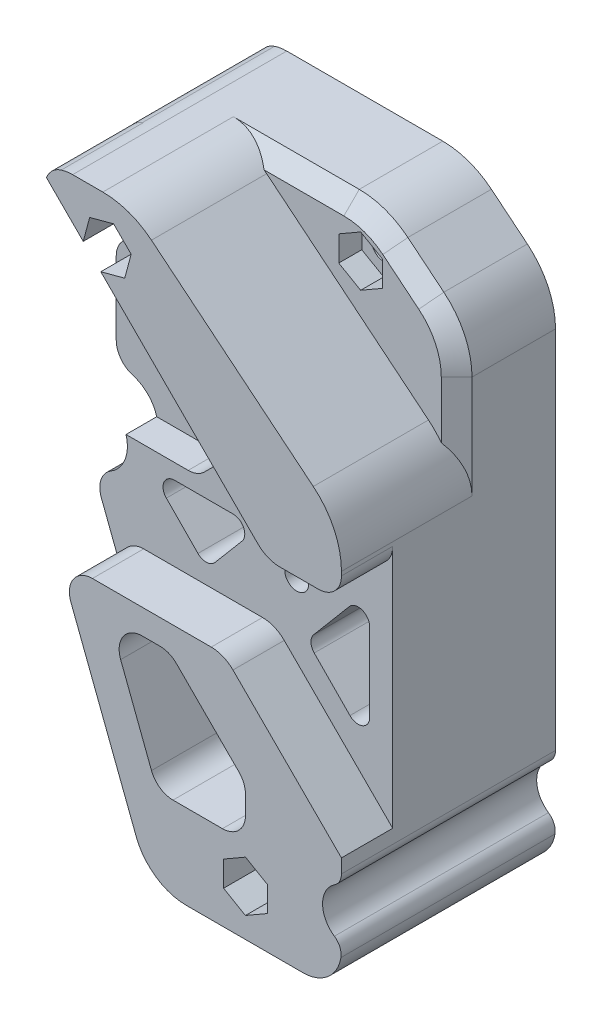
from build123d import *
from build123d.topology import SkipClean

# Parameters (mm, degrees)
SKETCH1_R            = 1.5
SKETCH1_W            = 15
SKETCH1_H            = 37.5
BOSS_EXTRUDE1_DEPTH  = 2.85
FILLET1_R            = 5
FILLET2_R            = 2
BOSS_EXTRUDE2_START  = 3.5
SKETCH5_R            = 1.5
BOSS_EXTRUDE2_DEPTH  = 3.5
FILLET3_R            = 3.5
FILLET4_R            = 2
FILLET5_R            = 2
SKETCH6_R            = 1.5
CUT_EXTRUDE1_DEPTH   = 10
SKETCH8_R            = 1.5
BOSS_EXTRUDE3_DEPTH  = 6.35
BOSS_EXTRUDE4_START  = 3.175
SKETCH9_R            = 1.5
BOSS_EXTRUDE4_DEPTH  = 3.175
SKETCH10_W           = 40
SKETCH10_H           = 15.399494937
SKETCH10_W_2         = 25
BOSS_EXTRUDE5_DEPTH  = 6.675
CUT_EXTRUDE2_START   = -6.675
CUT_EXTRUDE2_DEPTH   = 6.675
BOSS_EXTRUDE6_START  = -9.2
BOSS_EXTRUDE6_DEPTH  = 9.2
FILLET6_R            = 7
BOSS_EXTRUDE7_DEPTH  = 6.675
FILLET7_R            = 3
FILLET8_R            = 1.5
SKETCH14_R           = 1.5
CUT_EXTRUDE3_DEPTH   = 81.63507689
SKETCH15_R           = 1.55
CUT_EXTRUDE4_DEPTH   = 81.63507689
BOSS_EXTRUDE8_START  = 12
SKETCH17_R           = 1.55
BOSS_EXTRUDE8_DEPTH  = 12
SKETCH18_R           = 1.55
CUT_EXTRUDE5_DEPTH   = 15
CUT_EXTRUDE6_DEPTH   = 84.827296419
FILLET9_R            = 10
FILLET10_R           = 10
CUT_EXTRUDE7_DEPTH   = 4
FILLET11_R           = 3
BOSS_EXTRUDE9_START  = 4
BOSS_EXTRUDE9_DEPTH  = 4
FILLET12_R           = 3
CUT_EXTRUDE8_DEPTH   = 81.906365633
FILLET13_R           = 2
CUT_EXTRUDE9_DEPTH   = 84.827296419
FILLET14_R           = 3
CUT_EXTRUDE11_DEPTH  = 5
CUT_EXTRUDE12_DEPTH  = 3
SKETCH29_W           = 72.59
SKETCH29_H           = 13.5
CUT_EXTRUDE13_DEPTH  = 6.675
FILLET15_R           = 3
CHAMFER2_SIZE        = 2
SKETCH30_R           = 4.55
SKETCH30_R_2         = 1.55
CUT_EXTRUDE14_DEPTH  = 84.827296419
FILLET16_R           = 3
BOSS_EXTRUDE10_START = -17.2
BOSS_EXTRUDE10_DEPTH = 17.2
FILLET17_R           = 3
BOSS_EXTRUDE11_START = -17.2
BOSS_EXTRUDE11_DEPTH = 17.2
CUT_EXTRUDE15_START  = 10
CUT_EXTRUDE15_DEPTH  = 10
BOSS_EXTRUDE12_DEPTH = 5
CUT_EXTRUDE16_START  = -6.675
SKETCH35_R           = 1.55
CUT_EXTRUDE16_DEPTH  = 6.675
FILLET18_R           = 4
SKETCH36_R           = 3.5
CUT_EXTRUDE17_DEPTH  = 84.827296419
FILLET19_R           = 2
CUT_EXTRUDE18_DEPTH  = 82.850107051
FILLET20_R           = 1.5
CUT_EXTRUDE19_DEPTH  = 82.850107051
FILLET21_R           = 1.5
SCALE1_SCALE         = 0.333333333


with BuildPart() as part:
    # Sketch1 → Boss-Extrude1 (new body)
    # profile 1 of 2: a face of its own
    with BuildSketch(Plane.XY):
        Polygon((0, 37.5), (0, 0), (25, 0), (25, 75), (0, 75), align=None)
        with Locations((12.5, 6)):
            Circle(SKETCH1_R, mode=Mode.SUBTRACT)
        with Locations((12.5, 37.5)):
            Circle(SKETCH1_R, mode=Mode.SUBTRACT)
        with Locations((12.5, 69)):
            Circle(SKETCH1_R, mode=Mode.SUBTRACT)
    # profile 2 of 2: a face of its own
    with BuildSketch(Plane.XY):
        with Locations((-7.5, 56.25)):
            Rectangle(SKETCH1_W, SKETCH1_H)
    extrude(amount=BOSS_EXTRUDE1_DEPTH)

    # Fillet1
    fillet1_edges = [part.edges().sort_by_distance(p)[0] for p in [
        (25, 75, 1.425),
        (25, 0, 1.425),
        (0, 0, 1.425),
        (0, 37.5, 1.425),
        (-15, 75, 1.425),
    ]]
    fillet(fillet1_edges, radius=FILLET1_R)

    # Fillet2
    fillet2_edges = [part.edges().sort_by_distance(p)[0] for p in [
        (-15, 37.5, 1.425),
    ]]
    fillet(fillet2_edges, radius=FILLET2_R)

    # Sketch5 → Boss-Extrude2 (add)
    # profile 1 of 2: a face of its own
    with BuildSketch(Plane.XY.offset(2.85).offset(BOSS_EXTRUDE2_START)):
        with BuildLine():
            Line((-15, 42.5), (10.428932188, 42.5))
            Line((10.428932188, 42.5), (21.464466094, 53.535533906))
            Line((21.464466094, 53.535533906), (25, 57.071067812))
            Line((25, 57.071067812), (25, 70))
            ThreePointArc((25, 70), (23.535533906, 73.535533906), (20, 75))
            Line((20, 75), (-10, 75))
            ThreePointArc((-10, 75), (-13.535533906, 73.535533906), (-15, 70))
            Line((-15, 70), (-15, 42.5))
        make_face()
        with Locations((12.5, 69)):
            Circle(SKETCH5_R, mode=Mode.SUBTRACT)
    # profile 2 of 2: a face of its own
    with BuildSketch(Plane.XY.offset(2.85).offset(BOSS_EXTRUDE2_START)):
        with BuildLine():
            Line((14.571067812, 32.5), (0, 17.928932188))
            Line((0, 17.928932188), (0, 5))
            ThreePointArc((0, 5), (1.464466094, 1.464466094), (5, 0))
            Line((5, 0), (20, 0))
            ThreePointArc((20, 0), (23.535533906, 1.464466094), (25, 5))
            Line((25, 5), (25, 32.5))
            Line((25, 32.5), (14.571067812, 32.5))
        make_face()
        with Locations((12.5, 6)):
            Circle(SKETCH5_R, mode=Mode.SUBTRACT)
    extrude(amount=-BOSS_EXTRUDE2_DEPTH)

    # Fillet3
    fillet3_edges = [part.edges().sort_by_distance(p)[0] for p in [
        (10.428932188, 42.5, 4.6),
        (14.571067812, 32.5, 4.6),
    ]]
    fillet(fillet3_edges, radius=FILLET3_R)

    # Fillet4
    fillet4_edges = [part.edges().sort_by_distance(p)[0] for p in [
        (-15, 42.5, 4.6),
    ]]
    fillet(fillet4_edges, radius=FILLET4_R)

    # Fillet5
    fillet5_edges = [part.edges().sort_by_distance(p)[0] for p in [
        (25, 57.071067812, 4.6),
        (25, 32.5, 4.6),
        (0, 17.928932188, 4.6),
    ]]
    fillet(fillet5_edges, radius=FILLET5_R)

    # Sketch6 → Cut-Extrude1 (cut)
    with BuildSketch(Plane.XY.offset(6.35)):
        with Locations((-5.5, 69)):
            Circle(SKETCH6_R)
    extrude(amount=-CUT_EXTRUDE1_DEPTH, mode=Mode.SUBTRACT)

    # Sketch8 → Boss-Extrude3 (add)
    with SkipClean():  # the faces are left unmerged after this step: merging them gives an invalid solid
        with BuildSketch(Plane(origin=(0, 0, 0), x_dir=(-1, 0, 0), z_dir=(0, 0, -1))):
            with BuildLine():
                ThreePointArc((0, 32.5), (1.464466094, 36.035533906), (5, 37.5))
                Line((5, 37.5), (13, 37.5))
                ThreePointArc((13, 37.5), (14.414213562, 38.085786438), (15, 39.5))
                Line((15, 39.5), (15, 70))
                ThreePointArc((15, 70), (13.535533906, 73.535533906), (10, 75))
                Line((10, 75), (-20, 75))
                ThreePointArc((-20, 75), (-23.535533906, 73.535533906), (-25, 70))
                Line((-25, 70), (-25, 5))
                ThreePointArc((-25, 5), (-23.535533906, 1.464466094), (-20, 0))
                Line((-20, 0), (-5, 0))
                ThreePointArc((-5, 0), (-1.464466094, 1.464466094), (0, 5))
                Line((0, 5), (0, 32.5))
            make_face()
            with Locations((-12.5, 6)):
                Circle(SKETCH8_R, mode=Mode.SUBTRACT)
            with Locations((-12.5, 69)):
                Circle(SKETCH8_R, mode=Mode.SUBTRACT)
            with Locations((-12.5, 37.5)):
                Circle(SKETCH8_R, mode=Mode.SUBTRACT)
            with Locations(Location((5.5, 69, 0), (0, 0, 180))):
                Circle(SKETCH8_R, mode=Mode.SUBTRACT)
        extrude(amount=BOSS_EXTRUDE3_DEPTH)
    add(part.part.scale(1), mode=Mode.REPLACE)  # the faces are merged on a copy

    # Sketch9 → Boss-Extrude4 (add)
    # profile 1 of 2: a face of its own
    with BuildSketch(Plane.XY.offset(6.35).offset(BOSS_EXTRUDE4_START)):
        with BuildLine():
            ThreePointArc((16.02081528, 32.5), (14.681423267, 32.233578364), (13.545941546, 31.474873734))
            Line((13.545941546, 31.474873734), (0.585786438, 18.514718626))
            ThreePointArc((0.585786438, 18.514718626), (0.152240935, 17.865871928), (0, 17.100505063))
            Line((0, 17.100505063), (0, 5))
            ThreePointArc((0, 5), (1.464466094, 1.464466094), (5, 0))
            Line((5, 0), (20, 0))
            ThreePointArc((20, 0), (23.535533906, 1.464466094), (25, 5))
            Line((25, 5), (25, 30.5))
            ThreePointArc((25, 30.5), (24.414213562, 31.914213562), (23, 32.5))
            Line((23, 32.5), (16.02081528, 32.5))
        make_face()
    # profile 2 of 2: a face of its own
    with BuildSketch(Plane.XY.offset(6.35).offset(BOSS_EXTRUDE4_START)):
        with BuildLine():
            ThreePointArc((8.97918472, 42.5), (10.318576733, 42.766421636), (11.454058454, 43.525126266))
            Line((11.454058454, 43.525126266), (24.414213562, 56.485281374))
            ThreePointArc((24.414213562, 56.485281374), (24.847759065, 57.134128072), (25, 57.899494937))
            Line((25, 57.899494937), (25, 70))
            ThreePointArc((25, 70), (23.535533906, 73.535533906), (20, 75))
            Line((20, 75), (-10, 75))
            ThreePointArc((-10, 75), (-13.535533906, 73.535533906), (-15, 70))
            Line((-15, 70), (-15, 44.5))
            ThreePointArc((-15, 44.5), (-14.414213562, 43.085786438), (-13, 42.5))
            Line((-13, 42.5), (8.97918472, 42.5))
        make_face()
        with Locations((-5.5, 69)):
            Circle(SKETCH9_R, mode=Mode.SUBTRACT)
        with Locations((12.5, 69)):
            Circle(SKETCH9_R, mode=Mode.SUBTRACT)
    extrude(amount=-BOSS_EXTRUDE4_DEPTH)

    # Sketch10 → Boss-Extrude5 (add)
    with SkipClean():  # the faces are left unmerged after this step: merging them gives an invalid solid
        with BuildSketch(Plane.XY.offset(9.525)):
            with Locations((5, 50.199747469)):
                Rectangle(SKETCH10_W, SKETCH10_H)
            with Locations((12.5, 24.800252531)):
                Rectangle(SKETCH10_W_2, SKETCH10_H)
        extrude(amount=-BOSS_EXTRUDE5_DEPTH)

    # Cut-Extrude2: read off the stored shape, not the designer's step
    # Cut-Extrude2 outline → Cut-Extrude2 (cut)
    with SkipClean():  # the faces are left unmerged after this step: merging them gives an invalid solid
        with BuildSketch(Plane.XY.offset(9.525).offset(CUT_EXTRUDE2_START)):
            Polygon((25, 32.5), (10.428932188, 32.5), (25, 17.928932188), align=None)
            with BuildLine():
                Line((-15, 42.5), (14.571067812, 42.5))
                Line((14.571067812, 42.5), (-14.682437359, 71.75350517))
                ThreePointArc((-14.682437359, 71.75350517), (-14.919968841, 70.891014367), (-15, 70))
                Line((-15, 70), (-15, 42.5))
            make_face()
        extrude(amount=CUT_EXTRUDE2_DEPTH, mode=Mode.SUBTRACT)

    # Sketch12 → Boss-Extrude6 (add)
    with BuildSketch(Plane(origin=(0, 0, -6.35), x_dir=(-1, 0, 0), z_dir=(0, 0, -1)).offset(BOSS_EXTRUDE6_START)):
        with BuildLine():
            Line((0, 0), (14.867488321, 38.784117768))
            ThreePointArc((14.867488321, 38.784117768), (14.133189202, 37.852006604), (13, 37.5))
            Line((13, 37.5), (5, 37.5))
            ThreePointArc((5, 37.5), (1.464466094, 36.035533906), (0, 32.5))
            Line((0, 32.5), (0, 5))
            ThreePointArc((0, 5), (-1.464466094, 1.464466094), (-5, 0))
            Line((-5, 0), (0, 0))
        make_face()
    extrude(amount=BOSS_EXTRUDE6_DEPTH)

    # Fillet6
    fillet6_edges = [part.edges().sort_by_distance(p)[0] for p in [
        (0, 0, -1.75),
    ]]
    fillet(fillet6_edges, radius=FILLET6_R)

    # Sketch13 → Boss-Extrude7 (add)
    with SkipClean():  # the faces are left unmerged after this step: merging them gives an invalid solid
        with BuildSketch(Plane.XY.offset(9.525)):
            with BuildLine():
                Line((0, 32.5), (0, 5))
                ThreePointArc((0, 5), (1.464466094, 1.464466094), (5, 0))
                Line((5, 0), (4.813322939, 0))
                ThreePointArc((4.813322939, 0), (0.847160732, 1.232023115), (-1.722886185, 4.494412187))
                Line((-1.722886185, 4.494412187), (-12.458537109, 32.5))
                Line((-12.458537109, 32.5), (0, 32.5))
            make_face()
        extrude(amount=-BOSS_EXTRUDE7_DEPTH)

    # Fillet7
    fillet7_edges = [part.edges().sort_by_distance(p)[0] for p in [
        (25, 42.5, 6.1875),
        (14.571067812, 42.5, 6.1875),
        (-14.682437359, 71.75350517, 4.6),
        (10.428932188, 32.5, 6.1875),
        (25, 17.928932188, 6.1875),
    ]]
    fillet(fillet7_edges, radius=FILLET7_R)

    # Fillet8
    # the kernel refuses this fillet: 1.5 mm, written as the material it takes off along each edge
    with BuildSketch(Plane(origin=(-12.458537109, 32.5, 14.978612885), x_dir=(0.35794111613384066, -0.9337441605605148, 0), z_dir=(0, 0, -1))) as fillet8_piece_1:
        with BuildLine():
            CenterArc((FILLET8_R * 1.45429676938, -FILLET8_R), FILLET8_R, 90, 110.97380664)
            Line((FILLET8_R * 0.520552608823, -FILLET8_R * 1.35794111613), (0, 0))
            Line((0, 0), (FILLET8_R * 1.45429676938, 0))
        make_face()
    extrude(amount=12.128612885, mode=Mode.SUBTRACT)

    # Sketch14 → Cut-Extrude3 (cut, through all)
    with SkipClean():  # the faces are left unmerged after this step: merging them gives an invalid solid
        with BuildSketch(Plane(origin=(0, 0, -6.35), x_dir=(-1, 0, 0), z_dir=(0, 0, -1))):
            with Locations((-12.5, 6)):
                Circle(SKETCH14_R)
        extrude(amount=-CUT_EXTRUDE3_DEPTH, mode=Mode.SUBTRACT)
    add(part.part.scale(1), mode=Mode.REPLACE)  # the faces are merged on a copy

    # Sketch15 → Cut-Extrude4 (cut, through all)
    with BuildSketch(Plane(origin=(0, 0, -6.35), x_dir=(-1, 0, 0), z_dir=(0, 0, -1))):
        with Locations((-12.5, 69)):
            Circle(SKETCH15_R)
        with Locations((5.5, 69)):
            Circle(SKETCH15_R)
        with Locations((-12.5, 37.5)):
            Circle(SKETCH15_R)
        with Locations((-12.5, 6)):
            Circle(SKETCH15_R)
    extrude(amount=-CUT_EXTRUDE4_DEPTH, mode=Mode.SUBTRACT)

    # Sketch17 → Boss-Extrude8 (add)
    with BuildSketch(Plane(origin=(0, 0, -6.35), x_dir=(-1, 0, 0), z_dir=(0, 0, -1)).offset(BOSS_EXTRUDE8_START)):
        with BuildLine():
            ThreePointArc((-25, 5), (-23.535533906, 1.464466094), (-20, 0))
            Line((-20, 0), (-4.813322939, 0))
            ThreePointArc((-4.813322939, 0), (-0.847160732, 1.232023115), (1.722886185, 4.494412187))
            Line((1.722886185, 4.494412187), (14.867488321, 38.784117768))
            ThreePointArc((14.867488321, 38.784117768), (14.966593075, 39.135978464), (15, 39.5))
            Line((15, 39.5), (15, 70))
            ThreePointArc((15, 70), (13.535533906, 73.535533906), (10, 75))
            Line((10, 75), (-20, 75))
            ThreePointArc((-20, 75), (-23.535533906, 73.535533906), (-25, 70))
            Line((-25, 70), (-25, 5))
        make_face()
        with Locations((-12.5, 37.5)):
            Circle(SKETCH17_R, mode=Mode.SUBTRACT)
        with Locations((-12.5, 69)):
            Circle(SKETCH17_R, mode=Mode.SUBTRACT)
        with Locations((5.5, 69)):
            Circle(SKETCH17_R, mode=Mode.SUBTRACT)
        with Locations((-12.5, 6)):
            Circle(SKETCH17_R, mode=Mode.SUBTRACT)
    extrude(amount=-BOSS_EXTRUDE8_DEPTH)

    # Sketch18 → Cut-Extrude5 (cut)
    with BuildSketch(Plane.XY.offset(9.525)):
        with BuildLine():
            Line((20, 75), (-2.5, 75))
            Line((-2.5, 75), (25, 52.5))
            Line((25, 52.5), (25, 70))
            ThreePointArc((25, 70), (23.535533906, 73.535533906), (20, 75))
        make_face()
        with Locations(Location((12.5, 69, 0), (0, 0, 180))):
            Circle(SKETCH18_R, mode=Mode.SUBTRACT)
    extrude(amount=-CUT_EXTRUDE5_DEPTH, mode=Mode.SUBTRACT)

    # Sketch19 → Cut-Extrude6 (cut, through all)
    with BuildSketch(Plane.XY.offset(9.525)):
        with BuildLine():
            Line((13.888888889, 75), (20, 70))
            Line((20, 70), (25, 65.909090909))
            Line((25, 65.909090909), (25, 70))
            ThreePointArc((25, 70), (23.535533906, 73.535533906), (20, 75))
            Line((20, 75), (13.888888889, 75))
        make_face()
    extrude(amount=-CUT_EXTRUDE6_DEPTH, mode=Mode.SUBTRACT)

    # Fillet9
    fillet9_edges = [part.edges().sort_by_distance(p)[0] for p in [
        (25, 65.909090909, -11.9125),
        (13.888888889, 75, -11.9125),
    ]]
    fillet(fillet9_edges, radius=FILLET9_R)

    # Fillet10
    fillet10_edges = [part.edges().sort_by_distance(p)[0] for p in [
        (-2.5, 75, 2.025),
        (25, 52.5, 2.025),
    ]]
    fillet(fillet10_edges, radius=FILLET10_R)

    # Sketch20 → Cut-Extrude7 (cut)
    with BuildSketch(Plane.XY.offset(2.85)):
        with BuildLine():
            Line((15.813708499, 42.5), (-15, 42.5))
            Line((-15, 42.5), (-15, 70))
            ThreePointArc((-15, 70), (-14.027685763, 72.962726346), (-11.488901041, 74.773172288))
            ThreePointArc((-11.488901041, 74.773172288), (-13.508490052, 72.626793087), (-12.71688076, 69.787948572))
            Line((-12.71688076, 69.787948572), (13.692388155, 43.378679656))
            ThreePointArc((13.692388155, 43.378679656), (14.665658202, 42.728361402), (15.813708499, 42.5))
        make_face()
    extrude(amount=-CUT_EXTRUDE7_DEPTH, mode=Mode.SUBTRACT)

    # Fillet11
    fillet11_edges = [part.edges().sort_by_distance(p)[0] for p in [
        (-15, 42.5, 0.85),
    ]]
    fillet(fillet11_edges, radius=FILLET11_R - 0.0001)  # a hair under: the kernel refuses the full size

    # Sketch21 → Boss-Extrude9 (add)
    with BuildSketch(Plane.XY.offset(-1.15).offset(BOSS_EXTRUDE9_START)):
        with BuildLine():
            Line((13.692388155, 43.378679656), (7.090070927, 49.980996885))
            Line((7.090070927, 49.980996885), (-0.390925959, 42.5))
            Line((-0.390925959, 42.5), (15.813708499, 42.5))
            ThreePointArc((15.813708499, 42.5), (14.665658202, 42.728361402), (13.692388155, 43.378679656))
        make_face()
    extrude(amount=-BOSS_EXTRUDE9_DEPTH)

    # Fillet12
    # the kernel refuses this fillet: 3 mm, written as the material it adds along each edge
    with BuildSketch(Plane(origin=(7.090070927, 49.980996885, 2.85), x_dir=(-0.7071067811865475, -0.7071067811865475, 0), z_dir=(0, 0, -1))) as fillet12_piece_1:
        with BuildLine():
            CenterArc((FILLET12_R, FILLET12_R), FILLET12_R, 180, 90)
            Line((0, FILLET12_R), (0, 0))
            Line((0, 0), (FILLET12_R, 0))
        make_face()
    extrude(amount=11.5)
    with BuildSketch(Plane(origin=(-0.390925959, 42.5, 2.85), x_dir=(-1, 0, 0), z_dir=(0, 0, -1))) as fillet12_piece_2:
        with BuildLine():
            CenterArc((FILLET12_R * 0.414213562373, FILLET12_R), FILLET12_R, 225, 45)
            Line((-FILLET12_R * 0.292893218813, FILLET12_R * 0.292893218813), (0, 0))
            Line((0, 0), (FILLET12_R * 0.414213562373, 0))
        make_face()
    extrude(amount=7.106601718)

    # Sketch22 → Cut-Extrude8 (cut, through all)
    with BuildSketch(Plane.XY.offset(-1.15)):
        Polygon((-11, 62.414213562), (-11, 46.5), (-2.047780208, 46.5), (1.433216677, 49.980996885), align=None)
    extrude(amount=-CUT_EXTRUDE8_DEPTH, mode=Mode.SUBTRACT)

    # Fillet13
    fillet13_edges = [part.edges().sort_by_distance(p)[0] for p in [
        (-11, 62.414213562, -9.75),
        (1.433216677, 49.980996885, -9.75),
        (-2.047780208, 46.5, -9.75),
        (-11, 46.5, -9.75),
    ]]
    fillet(fillet13_edges, radius=FILLET13_R)

    # Sketch23 → Cut-Extrude9 (cut, through all)
    with BuildSketch(Plane.XY.offset(9.525)):
        Polygon((12.503863742, 10.999998507), (12.508975645, 17.615220221), (2.63184073, 27.507632025), (-5.307543542, 27.513767173), (1.004807677, 11.008884386), align=None)
    extrude(amount=-CUT_EXTRUDE9_DEPTH, mode=Mode.SUBTRACT)

    # Fillet14
    fillet14_edges = [part.edges().sort_by_distance(p)[0] for p in [
        (12.508975645, 17.615220221, -4.4125),
        (12.503863742, 10.999998507, -4.4125),
        (1.004807677, 11.008884386, -4.4125),
        (-5.307543542, 27.513767173, -4.4125),
        (2.63184073, 27.507632025, -4.4125),
    ]]
    fillet(fillet14_edges, radius=FILLET14_R)

    # Sketch26 → Cut-Extrude11 (cut)
    with BuildSketch(Plane.XY.offset(9.525)):
        Polygon((-5.5, 72.290896534), (-8.35, 70.645448267), (-8.35, 67.354551733), (-5.5, 65.709103466), (-2.65, 67.354551733), (-2.65, 70.645448267), align=None)
        Polygon((12.5, 9.290896534), (9.65, 7.645448267), (9.65, 4.354551733), (12.5, 2.709103466), (15.35, 4.354551733), (15.35, 7.645448267), align=None)
    extrude(amount=-CUT_EXTRUDE11_DEPTH, mode=Mode.SUBTRACT)

    # Sketch28 → Cut-Extrude12 (cut)
    with BuildSketch(Plane.XY.offset(-5.475)):
        Polygon((12.5, 72.290896534), (9.65, 70.645448267), (9.65, 67.354551733), (12.5, 65.709103466), (15.35, 67.354551733), (15.35, 70.645448267), align=None)
    extrude(amount=-CUT_EXTRUDE12_DEPTH, mode=Mode.SUBTRACT)

    # Sketch29 → Cut-Extrude13 (cut)
    with BuildSketch(Plane.XY.offset(9.525)):
        with Locations((12.5, 37.5)):
            Rectangle(SKETCH29_W, SKETCH29_H)
    extrude(amount=-CUT_EXTRUDE13_DEPTH, mode=Mode.SUBTRACT)

    # Fillet15
    # the kernel refuses this fillet: 3 mm, written as the material it takes off along each edge
    with BuildSketch(Plane(origin=(-11.7561119, 30.75, 2.85), x_dir=(1, 0, 0), z_dir=(0, 0, 1))) as fillet15_piece_1:
        with BuildLine():
            CenterArc((4.331309406, -3), FILLET15_R, 90, 110.97380664)
            Line((1.530076924, -4.073823348), (1.249953676, -4.181205683))
            ThreePointArc((1.249953676, -4.181205683), (-0.201719543, -0.394294009), (-0.295803989, -0.05))
            Line((-0.295803989, -0.05), (0, 0.3))
            Line((0, 0.3), (4.331309406, 0.3))
            Line((4.331309406, 0.3), (4.331309406, 0))
        make_face()
    extrude(amount=17.554215294, mode=Mode.SUBTRACT)
    with BuildSketch(Plane(origin=(12.178932188, 30.75, 12.631601718), x_dir=(0.7071067811865475, -0.7071067811865475, 0), z_dir=(0, 0, -1)), Plane(origin=(12.821067812, 44.25, 12.631601718), x_dir=(-0.7071067811986319, 0.7071067811744632, 0), z_dir=(0, 0, -1))) as fillet15_piece_2:
        with BuildLine():
            CenterArc((FILLET15_R * 0.414213562373, FILLET15_R), FILLET15_R, 225, 45)
            Line((-FILLET15_R * 0.292893218813, FILLET15_R * 0.292893218813), (0, 0))
            Line((0, 0), (FILLET15_R * 0.414213562373, 0))
        make_face()
    extrude(amount=9.781601718, mode=Mode.SUBTRACT)
    with BuildSketch(Plane(origin=(24.727178029, 44.25, 17.055949404), x_dir=(-1, 0, 0), z_dir=(0, 0, -1))) as fillet15_piece_3:
        with BuildLine():
            CenterArc((2.727178029, 3), FILLET15_R, 180, 90)
            Line((-0.272821971, 3), (-0.572821971, 3))
            ThreePointArc((-0.572821971, 3), (-0.572821971, 1.25), (-0.272717803, -0.125))
            Line((-0.272717803, -0.125), (0, -0.3))
            Line((0, -0.3), (2.727178029, -0.3))
            Line((2.727178029, -0.3), (2.727178029, 0))
        make_face()
    extrude(amount=14.205949404, mode=Mode.SUBTRACT)

    # Chamfer2
    chamfer2_edges = [part.edges().sort_by_distance(p)[0] for p in [
        (25, 54.465754179, -5.475),
        (18.992005456, 70.824722809, -5.475),
        (2.124810663, 75, -5.475),
        (13.681119923, 74.417954394, -5.475),
        (24.036696825, 65.452601641, -5.475),
    ]]
    chamfer(chamfer2_edges, length=CHAMFER2_SIZE)

    # Sketch30 → Cut-Extrude14 (cut, through all)
    # profile 1 of 4: a face of its own
    with BuildSketch(Plane.XY.offset(9.525)):
        with Locations((-14.1, 41.25)):
            Circle(SKETCH30_R)
        with Locations((-14.1, 41.25)):
            Circle(SKETCH30_R_2, mode=Mode.SUBTRACT)
    # profile 2 of 4: a face of its own
    with BuildSketch(Plane.XY.offset(9.525)):
        with Locations((-14.1, 41.25)):
            Circle(SKETCH30_R_2)
    # profile 3 of 4: a face of its own
    with BuildSketch(Plane.XY.offset(9.525)):
        with BuildLine():
            ThreePointArc((-12.399025141, 69.470092953), (-17.871069849, 62.704114654), (-9.55, 65.25))
            ThreePointArc((-9.55, 65.25), (-9.633238145, 66.11633627), (-9.879907047, 66.950974859))
            Line((-9.879907047, 66.950974859), (-12.399025141, 69.470092953))
        make_face()
        with Locations((-14.1, 65.25)):
            Circle(SKETCH30_R_2, mode=Mode.SUBTRACT)
    # profile 4 of 4: a face of its own
    with BuildSketch(Plane.XY.offset(9.525)):
        with Locations((-14.1, 65.25)):
            Circle(SKETCH30_R_2)
    extrude(amount=-CUT_EXTRUDE14_DEPTH, mode=Mode.SUBTRACT)

    # Fillet16
    # the kernel refuses this fillet: 3 mm, written as the material it takes off along each edge
    with BuildSketch(Plane(origin=(-14.068604964, 36.700108314, -26.248136768), x_dir=(0.9611149406417938, 0.27614863909699233, 0), z_dir=(0, 0, 1))) as fillet16_piece_1:
        with BuildLine():
            CenterArc((3.261075411, -2.888992466), FILLET16_R, 105.635132773, 79.30819662)
            Line((0.272234164, -3.147503593), (0.212457339, -3.152673815))
            Line((0.212457339, -3.152673815), (-0.059776825, -0.005170223))
            Line((-0.059776825, -0.005170223), (0.016170622, 0.057779849))
            ThreePointArc((0.016170622, 0.057779849), (1.226272159, -0.108361426), (2.436373695, 0.057779849))
            Line((2.436373695, 0.057779849), (2.452544317, 0))
        make_face()
    extrude(amount=36.996273536, mode=Mode.SUBTRACT)
    with BuildSketch(Plane(origin=(-15, 45.710100896, -25.329919436), x_dir=(0, 1, 0), z_dir=(0, 0, 1))) as fillet16_piece_2:
        with BuildLine():
            CenterArc((2.791967775, -3), FILLET16_R, 90, 73.850434857)
            Line((-0.089648916, -2.165562914), (-0.147281249, -2.148874172))
            ThreePointArc((-0.147281249, -2.148874172), (0.026056665, -1.085715759), (-0.058814517, -0.011868132))
            Line((-0.058814517, -0.011868132), (0, 0.06))
            Line((0, 0.06), (2.791967775, 0.06))
            Line((2.791967775, 0.06), (2.791967775, 0))
        make_face()
    extrude(amount=31.159838873, mode=Mode.SUBTRACT)
    with BuildSketch(Plane(origin=(-15, 69.710100896, -33.548975293), x_dir=(0.56135886149615, 0.8275724914590542, 0), z_dir=(0, 0, 1))) as fillet16_piece_3:
        with BuildLine():
            CenterArc((4.259860146, -2.385075016), FILLET16_R, 52.657617518, 125.473269194)
            Line((1.261456314, -2.28722583), (0.961615931, -2.277440912))
            ThreePointArc((0.961615931, -2.277440912), (0.535688809, -1.196029246), (-0.210054978, -0.21418895))
            Line((-0.210054978, -0.21418895), (-0.168407658, 0.248271747))
            ThreePointArc((-0.168407658, 0.248271747), (0.071504865, 0.411009179), (6.261563114, 0.238507502))
            Line((6.261563114, 0.238507502), (6.079590117, 0))
        make_face()
    extrude(amount=47.597950587, mode=Mode.SUBTRACT)
    with BuildSketch(Plane(origin=(-15, 60.789899104, -25.329919437), x_dir=(0.9991442228087932, 0.041362084422968015, 0), z_dir=(0, 0, 1))) as fillet16_piece_4:
        with BuildLine():
            CenterArc((2.881951062, -2.913664726), FILLET16_R, 103.779016012, 73.850434859)
            Line((-0.115481607, -2.789578472), (-0.17543026, -2.787096747))
            Line((-0.17543026, -2.787096747), (-0.059948653, 0.002481725))
            Line((-0.059948653, 0.002481725), (0.014290666, 0.058273295))
            ThreePointArc((0.014290666, 0.058273295), (1.08370887, -0.070941833), (2.153127074, 0.058273295))
            Line((2.153127074, 0.058273295), (2.167417741, 0))
        make_face()
    extrude(amount=31.159838873, mode=Mode.SUBTRACT)

    # Sketch31 → Boss-Extrude10 (add)
    with BuildSketch(Plane.XY.offset(-1.15).offset(BOSS_EXTRUDE10_START)):
        with BuildLine():
            ThreePointArc((-11, 57.281781881), (-9.37321737, 58.125392925), (-7.963568423, 59.296286243))
            ThreePointArc((-7.963568423, 59.296286243), (-9.981615211, 59.328322399), (-11, 57.585786438))
            Line((-11, 57.585786438), (-11, 57.281781881))
        make_face()
        with BuildLine():
            ThreePointArc((-7.351666873, 46.5), (-8.991713224, 48.106231196), (-11, 49.218218119))
            Line((-11, 49.218218119), (-11, 48.5))
            ThreePointArc((-11, 48.5), (-10.414213562, 47.085786438), (-9, 46.5))
            Line((-9, 46.5), (-7.351666873, 46.5))
        make_face()
    extrude(amount=BOSS_EXTRUDE10_DEPTH)

    # Fillet17
    fillet17_edges = [part.edges().sort_by_distance(p)[0] for p in [
        (-11, 57.281781881, -9.75),
        (-11, 49.218218119, -9.75),
        (-7.351666873, 46.5, -9.75),
    ]]
    fillet(fillet17_edges, radius=FILLET17_R)

    # Sketch32 → Boss-Extrude11 (add)
    with BuildSketch(Plane.XY.offset(-1.15).offset(BOSS_EXTRUDE11_START)):
        with BuildLine():
            ThreePointArc((-9.041798191, 58.356735573), (-7.873313681, 58.690758473), (-6.769056829, 58.183270391))
            Line((-6.769056829, 58.183270391), (-7.585786438, 59))
            ThreePointArc((-7.585786438, 59), (-7.765754569, 59.159520283), (-7.963568423, 59.296286243))
            ThreePointArc((-7.963568423, 59.296286243), (-8.483004092, 58.803927012), (-9.041798191, 58.356735573))
        make_face()
    extrude(amount=BOSS_EXTRUDE11_DEPTH)

    # Sketch33 → Cut-Extrude15 (cut)
    with BuildSketch(Plane.XY.offset(2.85).offset(CUT_EXTRUDE15_START)):
        with BuildLine():
            Line((11.403984489, 38.596015511), (3.554537021, 46.445462979))
            Line((3.554537021, 46.445462979), (0.487753698, 43.378679656))
            ThreePointArc((0.487753698, 43.378679656), (-0.485516349, 42.728361402), (-1.633566646, 42.5))
            Line((-1.633566646, 42.5), (-2.045941546, 42.5))
            Line((-2.045941546, 42.5), (9.704058454, 30.75))
            Line((9.704058454, 30.75), (10.936291501, 30.75))
            ThreePointArc((10.936291501, 30.75), (12.084341798, 30.521638598), (13.057611845, 29.871320344))
            Line((13.057611845, 29.871320344), (24.121320344, 18.807611845))
            ThreePointArc((24.121320344, 18.807611845), (24.771638598, 17.834341798), (25, 16.686291501))
            Line((25, 16.686291501), (25, 25))
            Line((25, 25), (13.596015511, 36.403984489))
            ThreePointArc((13.596015511, 36.403984489), (11.403984489, 36.403984489), (11.403984489, 38.596015511))
        make_face()
        with BuildLine():
            Line((4.968750583, 47.859676542), (3.554537021, 46.445462979))
            Line((3.554537021, 46.445462979), (11.403984489, 38.596015511))
            ThreePointArc((11.403984489, 38.596015511), (13.09315932, 38.932013275), (14.05, 37.5))
            ThreePointArc((14.05, 37.5), (13.932013275, 36.90684068), (13.596015511, 36.403984489))
            Line((13.596015511, 36.403984489), (25, 25))
            Line((25, 25), (25, 34.545941546))
            Line((25, 34.545941546), (15.295941546, 44.25))
            Line((15.295941546, 44.25), (14.063708499, 44.25))
            ThreePointArc((14.063708499, 44.25), (12.915658202, 44.478361402), (11.942388155, 45.128679656))
            Line((11.942388155, 45.128679656), (4.968750583, 52.102317229))
            ThreePointArc((4.968750583, 52.102317229), (5.84743024, 49.980996885), (4.968750583, 47.859676542))
        make_face()
        with BuildLine():
            Line((10.936291501, 30.75), (9.704058454, 30.75))
            Line((9.704058454, 30.75), (41.589977839, -1.135919385))
            Line((41.589977839, -1.135919385), (46.362948612, 3.637051388))
            Line((46.362948612, 3.637051388), (25, 25))
            Line((25, 25), (25, 16.686291501))
            ThreePointArc((25, 16.686291501), (24.771638598, 17.834341798), (24.121320344, 18.807611845))
            Line((24.121320344, 18.807611845), (13.057611845, 29.871320344))
            ThreePointArc((13.057611845, 29.871320344), (12.084341798, 30.521638598), (10.936291501, 30.75))
        make_face()
        Polygon((51.135919385, 8.410022161), (25, 34.545941546), (25, 25), (46.362948612, 3.637051388), align=None)
        with BuildLine():
            Line((-16.589977839, 76.135919385), (-21.362948612, 71.362948612))
            Line((-21.362948612, 71.362948612), (3.554537021, 46.445462979))
            Line((3.554537021, 46.445462979), (4.968750583, 47.859676542))
            ThreePointArc((4.968750583, 47.859676542), (5.84743024, 49.980996885), (4.968750583, 52.102317229))
            Line((4.968750583, 52.102317229), (11.942388155, 45.128679656))
            ThreePointArc((11.942388155, 45.128679656), (12.915658202, 44.478361402), (14.063708499, 44.25))
            Line((14.063708499, 44.25), (15.295941546, 44.25))
            Line((15.295941546, 44.25), (-16.589977839, 76.135919385))
        make_face()
        with BuildLine():
            Line((3.554537021, 46.445462979), (-21.362948612, 71.362948612))
            Line((-21.362948612, 71.362948612), (-26.135919385, 66.589977839))
            Line((-26.135919385, 66.589977839), (-2.045941546, 42.5))
            Line((-2.045941546, 42.5), (-1.633566646, 42.5))
            ThreePointArc((-1.633566646, 42.5), (-0.485516349, 42.728361402), (0.487753698, 43.378679656))
            Line((0.487753698, 43.378679656), (3.554537021, 46.445462979))
        make_face()
    extrude(amount=-CUT_EXTRUDE15_DEPTH, mode=Mode.SUBTRACT)

    # Sketch34 → Boss-Extrude12 (add)
    with BuildSketch(Plane.XY.offset(9.525)):
        Polygon((-8.35, 67.895941546), (-7.069057949, 66.614999495), (-5.5, 65.709103466), (-2.65, 67.354551733), (-2.65, 70.645448267), (-5.5, 72.290896534), (-8.35, 70.645448267), align=None)
    extrude(amount=-BOSS_EXTRUDE12_DEPTH)

    # Sketch35 → Cut-Extrude16 (cut)
    # profile 1 of 2: a face of its own
    with BuildSketch(Plane.XY.offset(9.525).offset(CUT_EXTRUDE16_START)):
        Polygon((-7.782876713, 71.282876713), (-8.618467583, 68.164409129), (-6.335590871, 65.881532417), (-3.217123287, 66.717123287), (-2.381532417, 69.835590871), (-4.664409129, 72.118467583), align=None)
        with Locations(Location((-5.5, 69, 0), (0, 0, 180))):
            Circle(SKETCH35_R, mode=Mode.SUBTRACT)
    # profile 2 of 2: a face of its own
    with BuildSketch(Plane.XY.offset(9.525).offset(CUT_EXTRUDE16_START)):
        with Locations(Location((-5.5, 69, 0), (0, 0, 180))):
            Circle(SKETCH35_R)
    extrude(amount=CUT_EXTRUDE16_DEPTH, mode=Mode.SUBTRACT)

    # Fillet18
    fillet18_edges = [part.edges().sort_by_distance(p)[0] for p in [
        (15.295941546, 44.25, 6.1875),
        (9.704058454, 30.75, 6.1875),
    ]]
    fillet(fillet18_edges, radius=FILLET18_R)

    # Sketch36 → Cut-Extrude17 (cut, through all)
    with BuildSketch(Plane.XY.offset(9.525)):
        with Locations((26.042907782, 9.059893657)):
            Circle(SKETCH36_R)
    extrude(amount=-CUT_EXTRUDE17_DEPTH, mode=Mode.SUBTRACT)

    # Fillet19
    fillet19_edges = [part.edges().sort_by_distance(p)[0] for p in [
        (25, 5.718884324, -4.4125),
        (25, 12.400902989, -4.4125),
        (25, 5, -4.4125),
    ]]
    fillet(fillet19_edges, radius=FILLET19_R)

    # Sketch37 → Cut-Extrude18 (cut, through all)
    with BuildSketch(Plane.XY.offset(2.85)):
        Polygon((22, 22.776120123), (22, 39.5), (22, 40.773976069), (13.818679167, 31.084114616), align=None)
    extrude(amount=-CUT_EXTRUDE18_DEPTH, mode=Mode.SUBTRACT)

    # Fillet20
    fillet20_edges = [part.edges().sort_by_distance(p)[0] for p in [
        (22, 40.773976069, -7.75),
        (22, 22.776120123, -7.75),
        (13.818679167, 31.084114616, -7.75),
    ]]
    fillet(fillet20_edges, radius=FILLET20_R)

    # Sketch39 → Cut-Extrude19 (cut, through all)
    with BuildSketch(Plane.XY.offset(2.85)):
        Polygon((7.468449932, 40.5), (-6.99130201, 40.5), (0.793680456, 32.594480491), align=None)
    extrude(amount=-CUT_EXTRUDE19_DEPTH, mode=Mode.SUBTRACT)

    # Fillet21
    fillet21_edges = [part.edges().sort_by_distance(p)[0] for p in [
        (-6.99130201, 40.5, -7.75),
        (7.468449932, 40.5, -7.75),
        (0.793680456, 32.594480491, -7.75),
    ]]
    fillet(fillet21_edges, radius=FILLET21_R)


with BuildPart() as part_1:
    # Scale1: scaled about (7.569164121, 38.133313386, -6.224943502)
    add(part.part.scale(SCALE1_SCALE).moved(Location((5.046109414, 25.422208924, -4.149962335))))


solid = part_1.part
